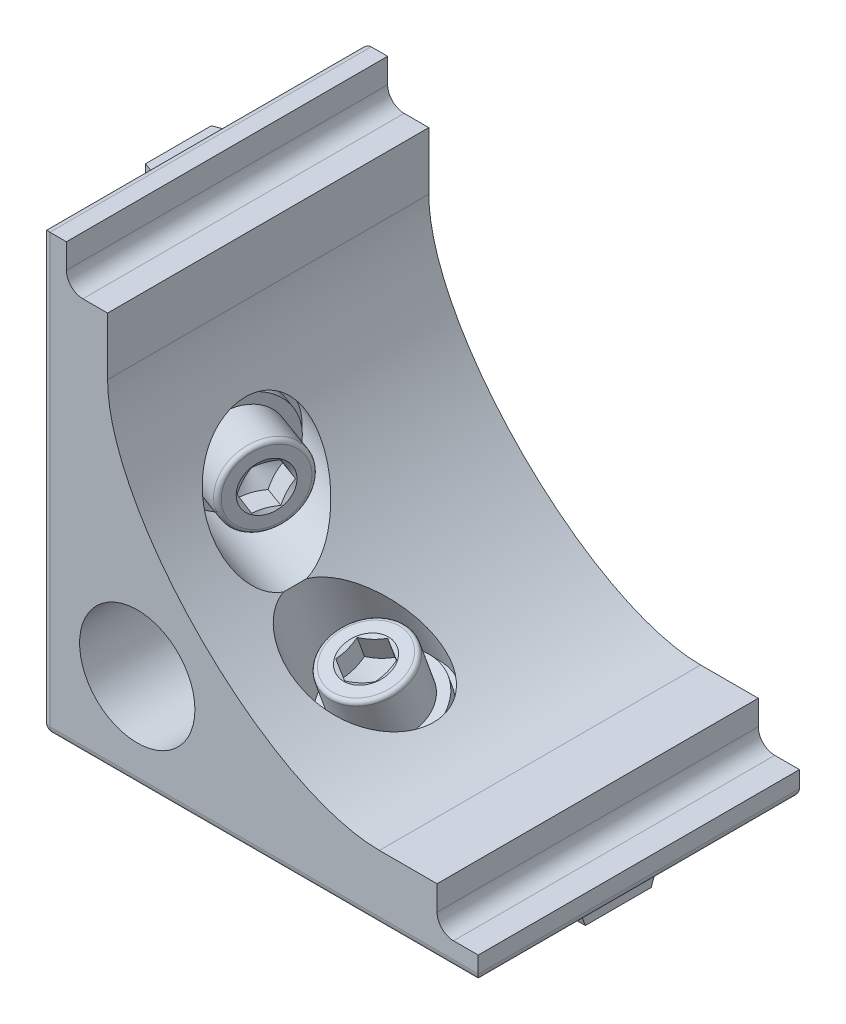
from build123d import *

# Parameters (mm, degrees)
SKETCH3_R           = 7
BOSS_EXTRUDE1_DEPTH = 19.5
BOSS_EXTRUDE2_DEPTH = 24.5
FILLET1_R           = 2
FILLET2_R           = 1
BOSS_EXTRUDE3_DEPTH = 12.5
CUT_EXTRUDE3_REACH  = 55.28
FILLET3_R           = 0.5


with BuildPart() as part:
    # Sketch3 → Boss-Extrude1 (new, symmetric)
    with BuildSketch(Plane.XY):
        with BuildLine():
            Line((-26, 53), (-23, 53))
            Line((-23, 53), (-23, 48))
            Line((-23, 48), (-18, 48))
            Line((-18, 48), (-18, 41))
            add(Edge.make_bspline(
                [(-18, 41), (-18, 27.341798915), (1.341798915, 8), (15, 8)],
                knots=[0, 0, 0, 0, 1, 1, 1, 1], degree=3))
            Line((15, 8), (22, 8))
            Line((22, 8), (22, 3))
            Line((22, 3), (27, 3))
            Line((27, 3), (27, 0))
            Line((27, 0), (-26, 0))
            Line((-26, 0), (-26, 53))
        make_face()
        with Locations((-14.4, 11.6)):
            Circle(SKETCH3_R, mode=Mode.SUBTRACT)
    extrude(amount=BOSS_EXTRUDE1_DEPTH, both=True)

    # Sketch6 → Boss-Extrude2 (add, symmetric)
    with BuildSketch(Plane(origin=(0, 0, 0), x_dir=(0, 0, -1), z_dir=(1, 0, 0))):
        Polygon((-4, -2.9), (4, -2.9), (5.055513679, 0), (-5.055513679, 0), align=None)
    boss_extrude2 = extrude(amount=BOSS_EXTRUDE2_DEPTH, both=True)

    # Fillet1
    fillet1_edges = [part.edges().sort_by_distance(p)[0] for p in [
        (-23, 48, 0),
        (22, 3, 0),
    ]]
    fillet(fillet1_edges, radius=FILLET1_R)

    # Fillet2
    fillet2_edges = [part.edges().sort_by_distance(p)[0] for p in [
        (0.5, 0, -19.5),
        (27, 0, 0),
        (0.5, 0, 19.5),
        (-26, 26.5, -19.5),
        (-26, 53, 0),
        (-26, 26.5, 19.5),
        (-26, 0, 0),
    ]]
    fillet(fillet2_edges, radius=FILLET2_R)


with BuildPart() as body_2:
    # Sketch7 → Boss-Extrude3 (new, symmetric)
    with BuildSketch(Plane(origin=(0, 0, 0), x_dir=(0, 0, -1), z_dir=(1, 0, 0))):
        with BuildLine():
            Line((5.951811032, -10.481053216), (7.257797729, -9.183813367))
            ThreePointArc((7.257797729, -9.183813367), (8.40157105, -7.484424253), (8.807951751, -5.476690332))
            ThreePointArc((8.807951751, -5.476690332), (8.495563879, -4.8650732), (7.816237548, -4.764189924))
            Line((7.816237548, -4.764189924), (5.524133229, -5.544554929))
            Line((5.524133229, -5.544554929), (4, -2.9))
            Line((4, -2.9), (-4, -2.9))
            Line((-4, -2.9), (-5.52615963, -5.54338602))
            Line((-5.52615963, -5.54338602), (-7.801440877, -4.715251372))
            ThreePointArc((-7.801440877, -4.715251372), (-8.487105577, -4.804934967), (-8.807951751, -5.41750085))
            ThreePointArc((-8.807951751, -5.41750085), (-8.415072056, -7.427920287), (-7.282744336, -9.134957107))
            Line((-7.282744336, -9.134957107), (-5.985504487, -10.440943804))
            ThreePointArc((-5.985504487, -10.440943804), (-3.08532669, -12.237943633), (0.313655308, -12.533174076))
            Line((0.313655308, -12.533174076), (5.951811032, -10.481053216))
        make_face()
    extrude(amount=BOSS_EXTRUDE3_DEPTH, both=True)


with BuildPart() as cut_revolve1_tool:
    # Sketch8 → Cut-Revolve1 (revolve)
    with BuildSketch(Plane(origin=(0, 0, 0), x_dir=(0, 0, -1), z_dir=(1, 0, 0))):
        Polygon((3.13273317, -11.507113646), (-12.877389448, 32.480336729), (-19.220314638, 30.171700761), (-9.985770768, 4.8), (-6.46192344, 6.082575537), (0.313655308, -12.533174076), align=None)
    cut_revolve1 = revolve(axis=Axis((0, 16.25066036, 6.970270338), (0, -0.9396926207859128, -0.3420201433256569)))


with BuildPart() as part_1:
    add(part.part)

    # Cut-Revolve1: cut by cut_revolve1_tool
    add(cut_revolve1_tool.part, mode=Mode.SUBTRACT)

    # Mirror1: Boss-Extrude2, Cut-Revolve1 across plane
    add(boss_extrude2.mirror(Plane(origin=(-13, 13, 0), x_dir=(0, 0, 1), z_dir=(0.7071067811865486, -0.7071067811865465, 0))))
    add(cut_revolve1.mirror(Plane(origin=(-13, 13, 0), x_dir=(0, 0, 1), z_dir=(0.7071067811865486, -0.7071067811865465, 0))), mode=Mode.SUBTRACT)


with BuildPart() as body_2_1:
    add(body_2.part)

    # Cut-Revolve1: cut by cut_revolve1_tool
    add(cut_revolve1_tool.part, mode=Mode.SUBTRACT)


with BuildPart() as body_3:
    # Sketch9 → Revolve1 (revolve)
    with BuildSketch(Plane(origin=(0, 0, 0), x_dir=(0, 0, -1), z_dir=(1, 0, 0))):
        Polygon((1.065409404, -12.259557961), (3.13273317, -11.507113646), (-4.666976793, 9.922413356), (-7.396156095, 10.403641303), (-8.381174108, 13.10995605), (-10.636436398, 12.289107706), (-8.666400373, 6.876478211), (-6.974953655, 7.492114469), (-6.46192344, 6.082575537), (0.040039193, -11.781419979), align=None)
    revolve(axis=Axis((0, 9.922413356, 4.666976793), (0, 0.9396926207859128, 0.3420201433256568)))

    # Cut-Extrude3: up to this cone (the profile starts inside it)
    cut_extrude3_end = Plane(origin=(0, 13.930804105, 6.125911713), z_dir=(0, 0.9396926207859128, 0.3420201433256568)).offset(-4.265639338) * Cone(1.732e-06, 116.799020851, 67.433945129, align=(Align.CENTER, Align.CENTER, Align.MIN), mode=Mode.PRIVATE)
    # Sketch10 → Cut-Extrude3 (cut, up to the surface)
    with BuildSketch(Plane(origin=(0, 14.270039952, 5.193869784), x_dir=(1, 0, 0), z_dir=(0, 0.9396926207859126, 0.3420201433256571)), mode=Mode.PRIVATE) as cut_extrude3_sk1:
        Polygon((0, 1.779422876), (-2.4, 0.39378223), (-2.4, -2.377499062), (0, -3.763139708), (2.4, -2.377499062), (2.4, 0.39378223), align=None)
    cut_extrude3_tool1 = extrude(cut_extrude3_sk1.sketch, amount=-CUT_EXTRUDE3_REACH, mode=Mode.PRIVATE) & cut_extrude3_end
    add(cut_extrude3_tool1.solids().sort_by_distance((0, 13.930804, 6.125912))[0], mode=Mode.SUBTRACT)

    # Cut-Extrude4 cone 1 section (through the dimple's axis) → Cut-Extrude4 (revolve, cut)
    with BuildSketch(Plane(origin=(0, 13.930804394, 6.125911818), x_dir=(0, -0.342020143, 0.939692621), z_dir=(1, 0, 0))):
        Polygon((0, 0), (2.88, 0), (0, 1.662768775), align=None)
    revolve(axis=Axis((0, 13.930804394, 6.125911818), (0, -0.939692621, -0.342020143)), mode=Mode.SUBTRACT)

    # Fillet3
    fillet3_edges = [body_3.edges().sort_by_distance(p)[0] for p in [
        (0, 15.572501082, 1.615387239),
    ]]
    fillet(fillet3_edges, radius=FILLET3_R)


with BuildPart() as body_4:
    # Sketch9<3> → Revolve2 (revolve)
    with BuildSketch(Plane(origin=(0, 0, 0), x_dir=(0, 0, -1), z_dir=(1, 0, 0))):
        Polygon((-9.351478249, 5.030863597), (-6.46192344, 6.082575537), (-6.974953655, 7.492114469), (-8.666400373, 6.876478211), (-9.864508464, 6.440402528), align=None)
    revolve(axis=Axis((0, 9.922413356, 4.666976793), (0, 0.9396926207859128, 0.3420201433256568)))


with BuildPart() as body_5:
    # Mirror2: mirrored copy
    add(body_3.part.mirror(Plane(origin=(-13, 13, 0), x_dir=(0, 0, 1), z_dir=(0.7071067811865486, -0.7071067811865465, 0))))


with BuildPart() as body_6:
    # Mirror2 2: mirrored copy
    add(body_4.part.mirror(Plane(origin=(-13, 13, 0), x_dir=(0, 0, 1), z_dir=(0.7071067811865486, -0.7071067811865465, 0))))


with BuildPart() as body_7:
    # Mirror2 3: mirrored copy
    add(body_2_1.part.mirror(Plane(origin=(-13, 13, 0), x_dir=(0, 0, 1), z_dir=(0.7071067811865486, -0.7071067811865465, 0))))


solid = Compound([part_1.part, body_2_1.part, body_3.part, body_4.part, body_5.part, body_6.part, body_7.part])
